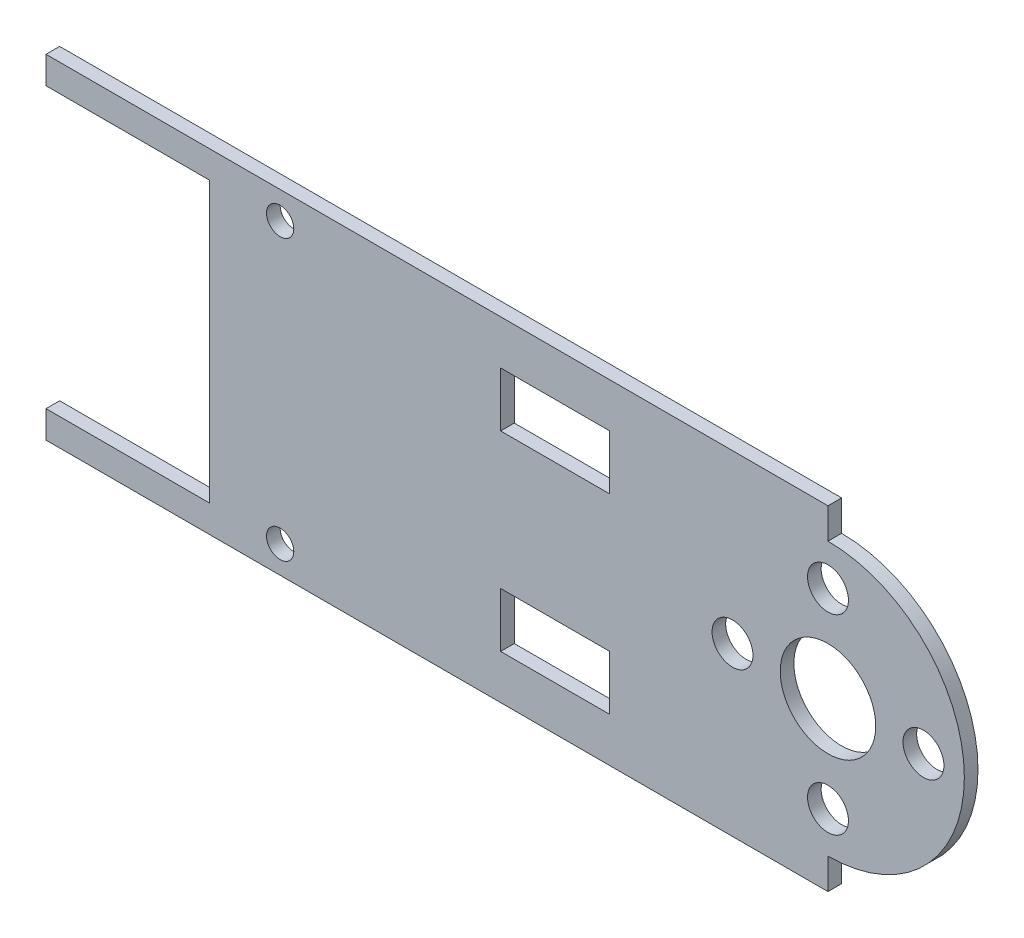
from build123d import *

# Parameters (mm, degrees)
SKETCH1_R           = 1
SKETCH1_R_2         = 1.5
SKETCH1_R_3         = 3.5
SKETCH1_W           = 8
SKETCH1_H           = 4
BOSS_EXTRUDE1_DEPTH = 1


with BuildPart() as part:
    # Sketch1 → Boss-Extrude1 (new body)
    with BuildSketch(Plane.XY):
        with BuildLine():
            Line((-5.166471095, 12.25), (-17.166471095, 12.25))
            Line((-17.166471095, 12.25), (-17.166471095, 10.25))
            Line((-17.166471095, 10.25), (-5.166471095, 10.25))
            Line((-5.166471095, 10.25), (-5.166471095, -10.25))
            Line((-5.166471095, -10.25), (-17.166471095, -10.25))
            Line((-17.166471095, -10.25), (-17.166471095, -12.25))
            Line((-17.166471095, -12.25), (-5.166471095, -12.25))
            Line((-5.166471095, -12.25), (5.166471095, -12.25))
            Line((5.166471095, -12.25), (40.166471095, -12.25))
            Line((40.166471095, -12.25), (40.166471095, -10))
            ThreePointArc((40.166471095, -10), (50.166471095, 0), (40.166471095, 10))
            Line((40.166471095, 10), (40.166471095, 12.25))
            Line((40.166471095, 12.25), (5.166471095, 12.25))
            Line((5.166471095, 12.25), (-5.166471095, 12.25))
        make_face()
        with Locations((0, 10.25)):
            Circle(SKETCH1_R, mode=Mode.SUBTRACT)
        with Locations((0, -10.25)):
            Circle(SKETCH1_R, mode=Mode.SUBTRACT)
        with Locations((40.166471095, 7)):
            Circle(SKETCH1_R_2, mode=Mode.SUBTRACT)
        with Locations((47.166471095, 0)):
            Circle(SKETCH1_R_2, mode=Mode.SUBTRACT)
        with Locations((40.166471095, -7)):
            Circle(SKETCH1_R_2, mode=Mode.SUBTRACT)
        with Locations((33.166471095, 0)):
            Circle(SKETCH1_R_2, mode=Mode.SUBTRACT)
        with Locations((40.166471095, 0)):
            Circle(SKETCH1_R_3, mode=Mode.SUBTRACT)
        with Locations((20.166471095, 7)):
            Rectangle(SKETCH1_W, SKETCH1_H, mode=Mode.SUBTRACT)
        with Locations((20.166471095, -7)):
            Rectangle(SKETCH1_W, SKETCH1_H, mode=Mode.SUBTRACT)
    extrude(amount=BOSS_EXTRUDE1_DEPTH)


solid = part.part
